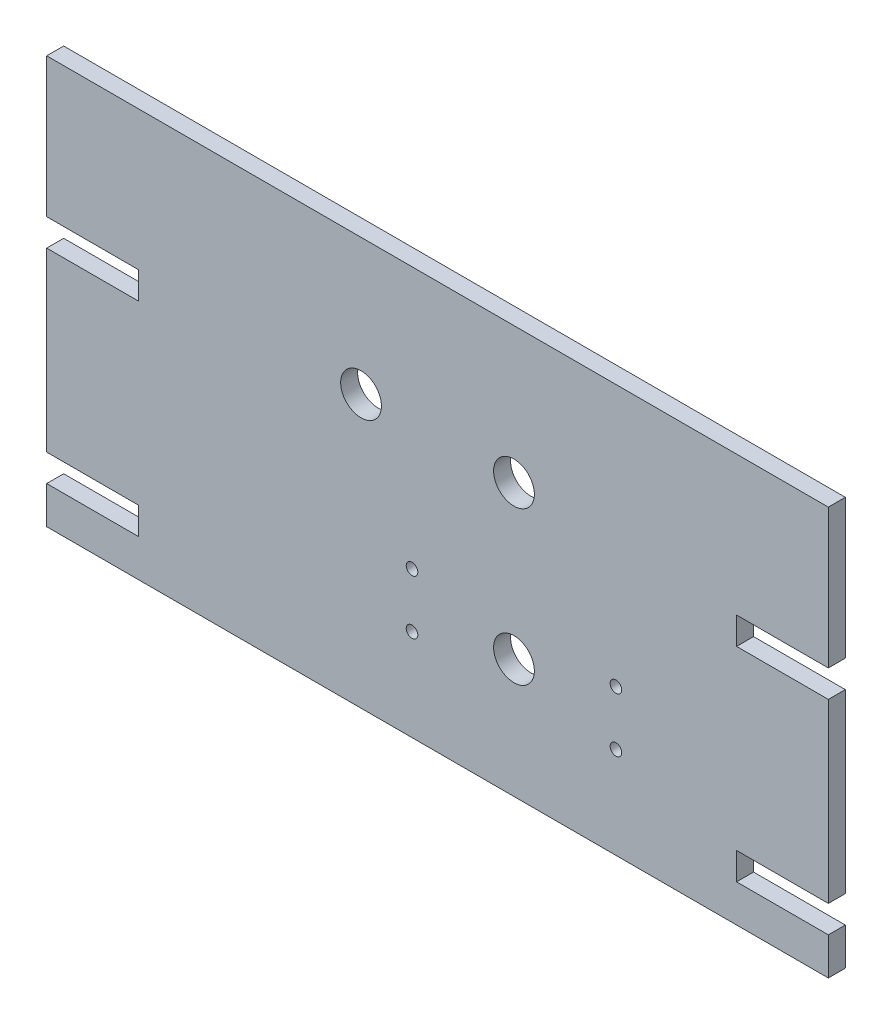
from build123d import *

# Parameters (mm, degrees)
SKETCH1_W            = 230
SKETCH1_H            = 120
BOSS_EXTRUDE1_DEPTH  = 5
CUT_EXTRUDE1_REACH   = 131.808
SKETCH2_W            = 27
SKETCH2_H            = 8.000000001
CUT_EXTRUDE2_REACH   = 131.808
SKETCH3_R            = 6
M3_CLEARANCE_HOLE1_D = 3.4


with BuildPart() as part:
    # Sketch1 → Boss-Extrude1 (new body)
    with BuildSketch(Plane.XY):
        Rectangle(SKETCH1_W, SKETCH1_H)
    extrude(amount=BOSS_EXTRUDE1_DEPTH)

    # Sketch2 → Cut-Extrude1 (cut, up to next)
    with BuildSketch(Plane(origin=(0, 0, 0), x_dir=(-1, 0, 0), z_dir=(0, 0, -1)), mode=Mode.PRIVATE) as cut_extrude1_sk1:
        with Locations((101.5, 15.000000001)):
            Rectangle(SKETCH2_W, SKETCH2_H)
    cut_extrude1_tool1 = extrude(cut_extrude1_sk1.sketch, amount=-CUT_EXTRUDE1_REACH, mode=Mode.PRIVATE) & part.part
    # Sketch2 → Cut-Extrude1 (cut, up to next)
    with BuildSketch(Plane(origin=(0, 0, 0), x_dir=(-1, 0, 0), z_dir=(0, 0, -1)), mode=Mode.PRIVATE) as cut_extrude1_sk2:
        with Locations((101.5, -45.000000001)):
            Rectangle(SKETCH2_W, SKETCH2_H)
    cut_extrude1_tool2 = extrude(cut_extrude1_sk2.sketch, amount=-CUT_EXTRUDE1_REACH, mode=Mode.PRIVATE) & part.part
    # Sketch2 → Cut-Extrude1 (cut, up to next)
    with BuildSketch(Plane(origin=(0, 0, 0), x_dir=(-1, 0, 0), z_dir=(0, 0, -1)), mode=Mode.PRIVATE) as cut_extrude1_sk3:
        with Locations((-101.5, -45.000000001)):
            Rectangle(SKETCH2_W, SKETCH2_H)
    cut_extrude1_tool3 = extrude(cut_extrude1_sk3.sketch, amount=-CUT_EXTRUDE1_REACH, mode=Mode.PRIVATE) & part.part
    # Sketch2 → Cut-Extrude1 (cut, up to next)
    with BuildSketch(Plane(origin=(0, 0, 0), x_dir=(-1, 0, 0), z_dir=(0, 0, -1)), mode=Mode.PRIVATE) as cut_extrude1_sk4:
        with Locations((-101.5, 15.000000001)):
            Rectangle(SKETCH2_W, SKETCH2_H)
    cut_extrude1_tool4 = extrude(cut_extrude1_sk4.sketch, amount=-CUT_EXTRUDE1_REACH, mode=Mode.PRIVATE) & part.part
    add(cut_extrude1_tool1.solids().sort_by_distance((-101.5, 15, 0))[0], mode=Mode.SUBTRACT)
    add(cut_extrude1_tool2.solids().sort_by_distance((-101.5, -45, 0))[0], mode=Mode.SUBTRACT)
    add(cut_extrude1_tool3.solids().sort_by_distance((101.5, -45, 0))[0], mode=Mode.SUBTRACT)
    add(cut_extrude1_tool4.solids().sort_by_distance((101.5, 15, 0))[0], mode=Mode.SUBTRACT)

    # Sketch3 → Cut-Extrude2 (cut, up to next)
    with BuildSketch(Plane.XY.offset(5), mode=Mode.PRIVATE) as cut_extrude2_sk1:
        with Locations((22.5, 20)):
            Circle(SKETCH3_R)
    cut_extrude2_tool1 = extrude(cut_extrude2_sk1.sketch, amount=-CUT_EXTRUDE2_REACH, mode=Mode.PRIVATE) & part.part
    # Sketch3 → Cut-Extrude2 (cut, up to next)
    with BuildSketch(Plane.XY.offset(5), mode=Mode.PRIVATE) as cut_extrude2_sk2:
        with Locations((-22.5, 20)):
            Circle(SKETCH3_R)
    cut_extrude2_tool2 = extrude(cut_extrude2_sk2.sketch, amount=-CUT_EXTRUDE2_REACH, mode=Mode.PRIVATE) & part.part
    # Sketch3 → Cut-Extrude2 (cut, up to next)
    with BuildSketch(Plane.XY.offset(5), mode=Mode.PRIVATE) as cut_extrude2_sk3:
        with Locations((22.5, -25)):
            Circle(SKETCH3_R)
    cut_extrude2_tool3 = extrude(cut_extrude2_sk3.sketch, amount=-CUT_EXTRUDE2_REACH, mode=Mode.PRIVATE) & part.part
    add(cut_extrude2_tool1.solids().sort_by_distance((22.5, 20, 5))[0], mode=Mode.SUBTRACT)
    add(cut_extrude2_tool2.solids().sort_by_distance((-22.5, 20, 5))[0], mode=Mode.SUBTRACT)
    add(cut_extrude2_tool3.solids().sort_by_distance((22.5, -25, 5))[0], mode=Mode.SUBTRACT)

    # M3 Clearance Hole1 (through all)
    with Locations(Plane(origin=(-7.5, -17, 5), x_dir=(1, 0, 0), z_dir=(0, 0, 1))):
        with Locations((0, 0), (60, 0), (60, -16), (0, -16)):
            Hole(M3_CLEARANCE_HOLE1_D / 2)


solid = part.part
